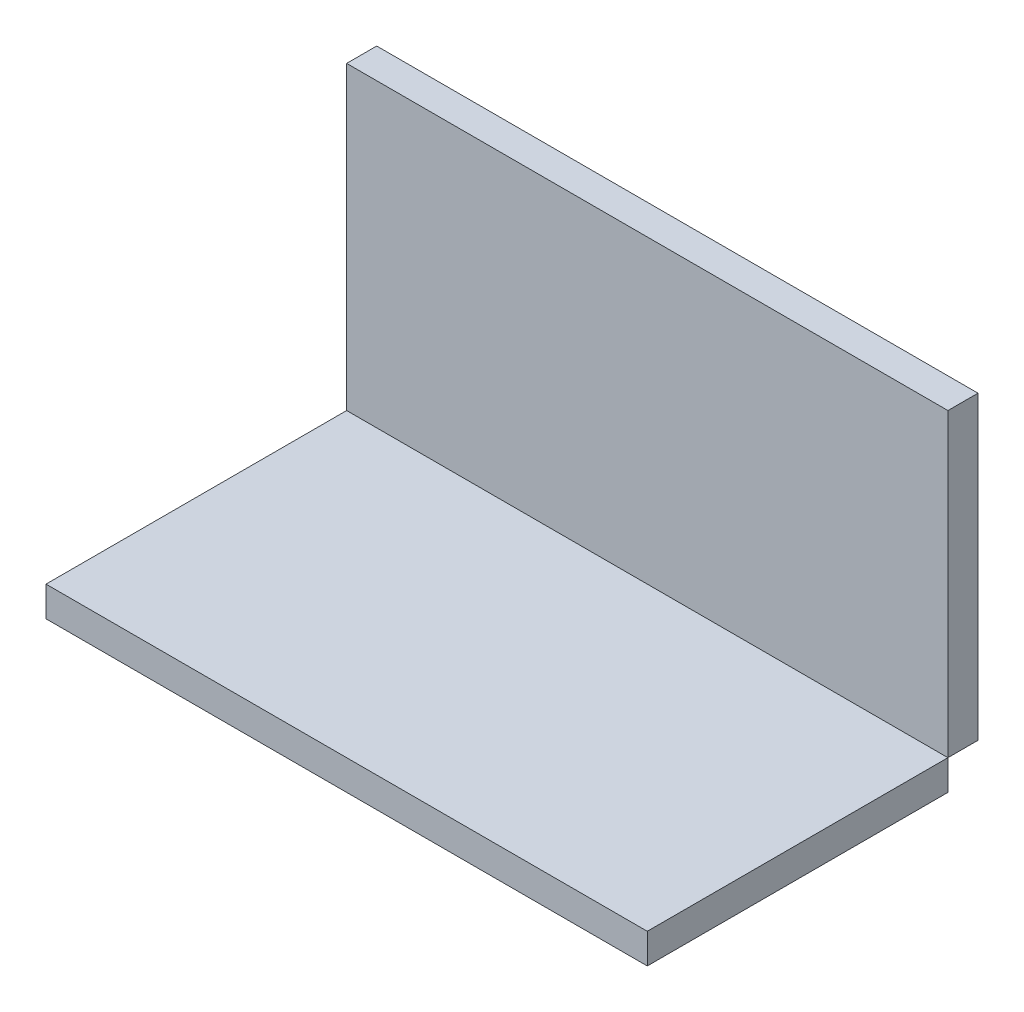
from build123d import *

# Parameters (mm, degrees)
SKETCH_1_W           = 20
SKETCH_1_H           = 10
BASEPLATE_DEPTH      = 1
LOFTEDBEND_OUTLINE_W = 1
LOFTEDBEND_OUTLINE_H = 10
LOFTEDBEND_DEPTH     = 20


# Read off the part's stored shape, not the designer's step: LoftedBend
# Sheet-metal steps are written as plain solids
with BuildPart() as part:
    # Sketch 1 → BasePlate (new body)
    with BuildSketch(Plane.XY):
        with Locations((10, 5)):
            Rectangle(SKETCH_1_W, SKETCH_1_H)
    extrude(amount=-BASEPLATE_DEPTH)


with BuildPart() as body_2:
    # LoftedBend outline → LoftedBend (new body)
    with BuildSketch(Plane.YZ):
        with Locations((-0.5, 5)):
            Rectangle(LOFTEDBEND_OUTLINE_W, LOFTEDBEND_OUTLINE_H)
    extrude(amount=LOFTEDBEND_DEPTH)


solid = Compound([part.part, body_2.part])
